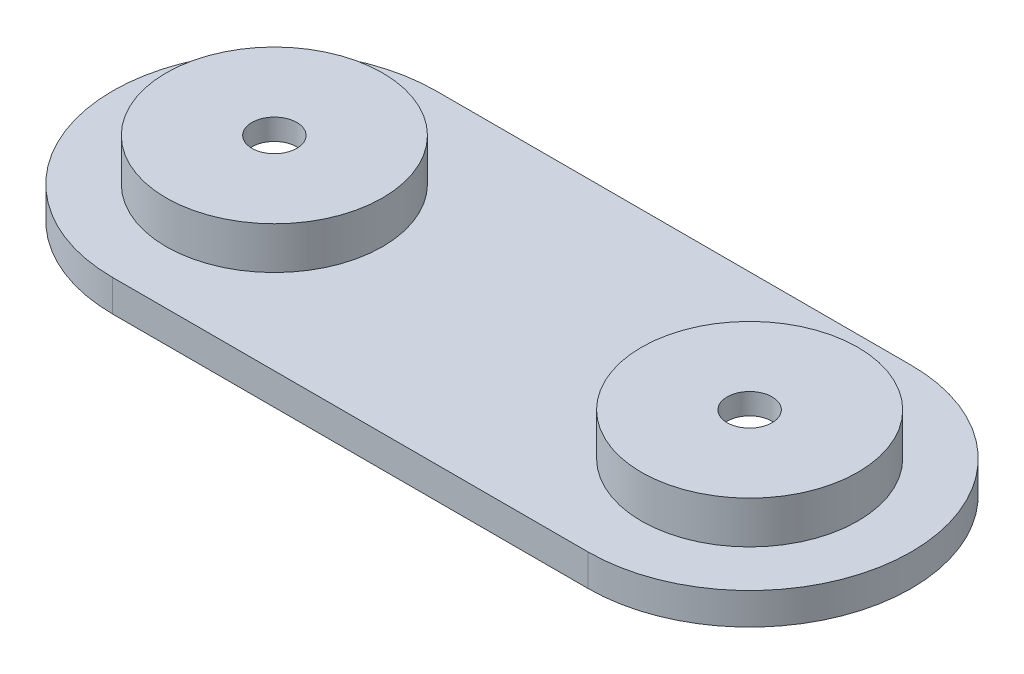
from build123d import *

# Parameters (mm, degrees)
BOSS_EXTRUDE1_DEPTH = 3
SKETCH2_R           = 9.5
CUT_EXTRUDE1_DEPTH  = 49.736551272
BOSS_EXTRUDE2_START = 2
SKETCH3_R           = 10.25
SKETCH3_R_2         = 9.5
BOSS_EXTRUDE2_DEPTH = 2
BOSS_EXTRUDE3_START = 2
SKETCH4_R           = 10.25
BOSS_EXTRUDE3_DEPTH = 2
SKETCH5_R           = 2.125
CUT_EXTRUDE2_DEPTH  = 2


with BuildPart() as part:
    # Sketch1 → Boss-Extrude1 (new body)
    with BuildSketch(Plane(origin=(0, 0, 0), x_dir=(1, 0, 0), z_dir=(0, 1, 0))):
        with BuildLine():
            Line((22.5, 0), (-22.5, 0))
            ThreePointArc((-22.5, 0), (-37.80530954, -15.30530954), (-22.5, -30.61061908))
            Line((-22.5, -30.61061908), (22.5, -30.61061908))
            ThreePointArc((22.5, -30.61061908), (37.80530954, -15.30530954), (22.5, 0))
        make_face()
    extrude(amount=BOSS_EXTRUDE1_DEPTH)

    # Sketch2 → Cut-Extrude1 (cut, through all)
    with BuildSketch(Plane(origin=(0, 3, 0), x_dir=(1, 0, 0), z_dir=(0, 1, 0))):
        with Locations((-22.5, -15.30530954)):
            Circle(SKETCH2_R)
        with Locations((22.5, -15.30530954)):
            Circle(SKETCH2_R)
    extrude(amount=-CUT_EXTRUDE1_DEPTH, mode=Mode.SUBTRACT)

    # Sketch3 → Boss-Extrude2 (add)
    # profile 1 of 2: a face of its own
    with BuildSketch(Plane(origin=(0, 3, 0), x_dir=(1, 0, 0), z_dir=(0, 1, 0)).offset(BOSS_EXTRUDE2_START)):
        with Locations((22.5, -15.30530954)):
            Circle(SKETCH3_R)
        with Locations((22.5, -15.30530954)):
            Circle(SKETCH3_R_2, mode=Mode.SUBTRACT)
    # profile 2 of 2: a face of its own
    with BuildSketch(Plane(origin=(0, 3, 0), x_dir=(1, 0, 0), z_dir=(0, 1, 0)).offset(BOSS_EXTRUDE2_START)):
        with Locations((-22.5, -15.30530954)):
            Circle(SKETCH3_R)
        with Locations((-22.5, -15.30530954)):
            Circle(SKETCH3_R_2, mode=Mode.SUBTRACT)
    extrude(amount=-BOSS_EXTRUDE2_DEPTH)

    # Sketch4 → Boss-Extrude3 (add)
    with BuildSketch(Plane(origin=(0, 5, 0), x_dir=(1, 0, 0), z_dir=(0, 1, 0)).offset(BOSS_EXTRUDE3_START)):
        with Locations((22.5, -15.30530954)):
            Circle(SKETCH4_R)
        with Locations((-22.5, -15.30530954)):
            Circle(SKETCH4_R)
    extrude(amount=-BOSS_EXTRUDE3_DEPTH)

    # Sketch5 → Cut-Extrude2 (cut)
    with BuildSketch(Plane(origin=(0, 7, 0), x_dir=(1, 0, 0), z_dir=(0, 1, 0))):
        with Locations((22.5, -15.30530954)):
            Circle(SKETCH5_R)
        with Locations((-22.5, -15.30530954)):
            Circle(SKETCH5_R)
    extrude(amount=-CUT_EXTRUDE2_DEPTH, mode=Mode.SUBTRACT)


solid = part.part
